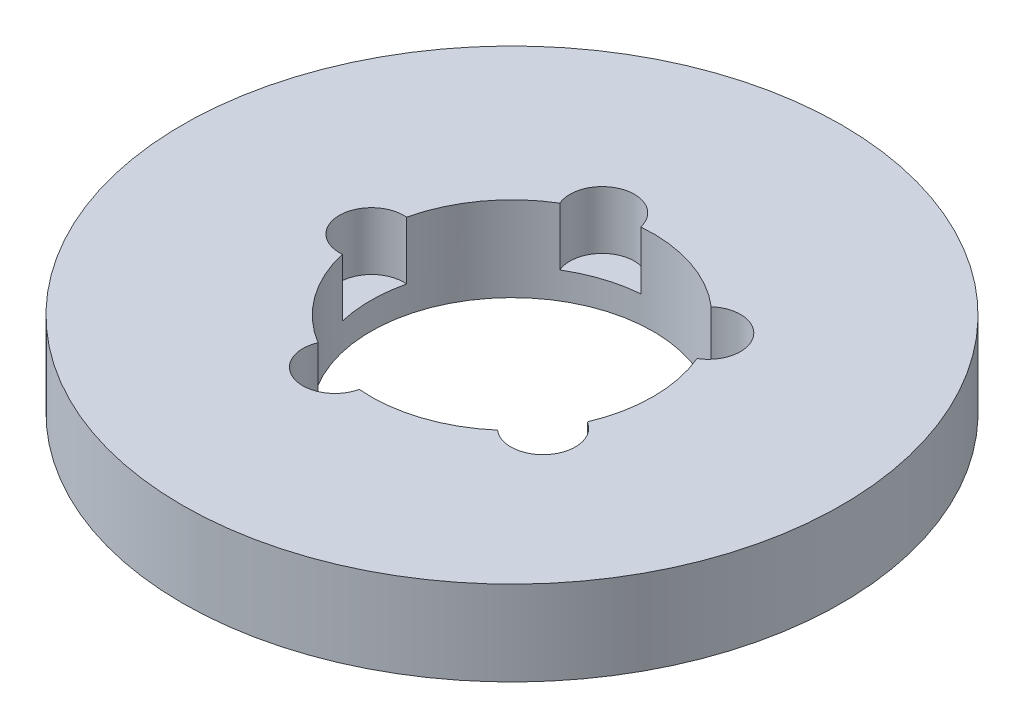
from build123d import *

# Parameters (mm, degrees)
SKETCH1_R           = 70
BOSS_EXTRUDE1_DEPTH = 18
SKETCH2_R           = 30
CUT_EXTRUDE1_DEPTH  = 101.618089825
SKETCH3_R           = 6.852756537
CUT_EXTRUDE2_DEPTH  = 12.299091949
CIRPATTERN1_COUNT   = 5


with BuildPart() as part:
    # Sketch1 → Boss-Extrude1 (new body)
    with BuildSketch(Plane(origin=(0, 0, 0), x_dir=(1, 0, 0), z_dir=(0, 1, 0))):
        Circle(SKETCH1_R)
    extrude(amount=BOSS_EXTRUDE1_DEPTH)

    # Sketch2 → Cut-Extrude1 (cut, through all)
    with BuildSketch(Plane(origin=(0, 0, 0), x_dir=(1, 0, 0), z_dir=(0, 1, 0))):
        Circle(SKETCH2_R)
    extrude(amount=CUT_EXTRUDE1_DEPTH, mode=Mode.SUBTRACT)

    # Sketch3 → Cut-Extrude2 (cut)
    with BuildSketch(Plane(origin=(0, 18, 0), x_dir=(1, 0, 0), z_dir=(0, 1, 0))):
        with Locations((-29.836323448, 0)):
            Circle(SKETCH3_R)
    cut_extrude2 = extrude(amount=-CUT_EXTRUDE2_DEPTH, mode=Mode.SUBTRACT)

    # CirPattern1: Cut-Extrude2 ×5 about axis
    cirpattern1_axis = Axis((0, 0, 0), (0, 1, 0))
    for i in range(1, CIRPATTERN1_COUNT):
        add(cut_extrude2.rotate(cirpattern1_axis, i * 360 / CIRPATTERN1_COUNT), mode=Mode.SUBTRACT)


solid = part.part
